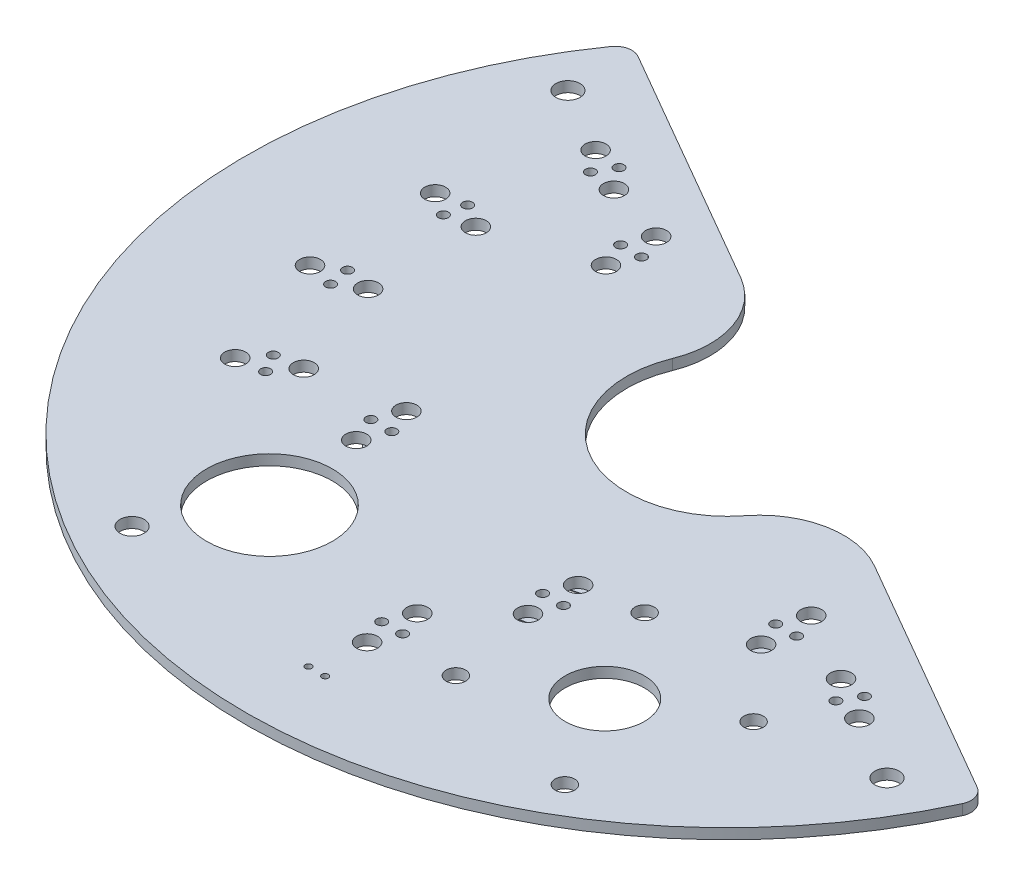
from build123d import *

# Parameters (mm, degrees)
SKETCH1_R           = 73.025
SKETCH1_R_2         = 15.24
SKETCH1_R_3         = 0.75
SKETCH1_R_4         = 1.585
SKETCH1_R_5         = 20
SKETCH1_R_6         = 9.525
SKETCH1_R_7         = 6
BOSS_EXTRUDE1_DEPTH = 1.5875
SKETCH2_R           = 1.8288
CUT_EXTRUDE1_DEPTH  = 104.285146107
CUT_EXTRUDE2_DEPTH  = 104.285146107
FILLET1_R           = 12.7
FILLET2_R           = 2.54
SKETCH4_R           = 0.4953
CUT_EXTRUDE3_DEPTH  = 104.285146107
SKETCH5_R           = 0.75
SKETCH5_R_2         = 0.4953
BOSS_EXTRUDE2_DEPTH = 0.1016
SKETCH6_R           = 1.4732
CUT_EXTRUDE4_DEPTH  = 104.285146107


with BuildPart() as part:
    # Sketch1 → Boss-Extrude1 (new body)
    with BuildSketch(Plane(origin=(0, 0, 0), x_dir=(1, 0, 0), z_dir=(0, 1, 0))):
        Circle(SKETCH1_R)
        Circle(SKETCH1_R_2, mode=Mode.SUBTRACT)
        with Locations((-1.585, 50.8)):
            Circle(SKETCH1_R_3, mode=Mode.SUBTRACT)
        with Locations((1.585, 50.8)):
            Circle(SKETCH1_R_3, mode=Mode.SUBTRACT)
        with Locations((0, 54.6)):
            Circle(SKETCH1_R_4, mode=Mode.SUBTRACT)
        with Locations((0, 47)):
            Circle(SKETCH1_R_4, mode=Mode.SUBTRACT)
        with Locations((47.284987047, 27.3)):
            Circle(SKETCH1_R_4, mode=Mode.SUBTRACT)
        with Locations((43.201590512, 26.772650265)):
            Circle(SKETCH1_R_3, mode=Mode.SUBTRACT)
        with Locations((44.786590512, 24.027349735)):
            Circle(SKETCH1_R_3, mode=Mode.SUBTRACT)
        with Locations((40.703193978, 23.5)):
            Circle(SKETCH1_R_4, mode=Mode.SUBTRACT)
        with Locations((47.284987047, -27.3)):
            Circle(SKETCH1_R_4, mode=Mode.SUBTRACT)
        with Locations((44.786590512, -24.027349735)):
            Circle(SKETCH1_R_3, mode=Mode.SUBTRACT)
        with Locations((43.201590512, -26.772650265)):
            Circle(SKETCH1_R_3, mode=Mode.SUBTRACT)
        with Locations((40.703193978, -23.5)):
            Circle(SKETCH1_R_4, mode=Mode.SUBTRACT)
        with Locations((0, -54.6)):
            Circle(SKETCH1_R_4, mode=Mode.SUBTRACT)
        with Locations((1.585, -50.8)):
            Circle(SKETCH1_R_3, mode=Mode.SUBTRACT)
        with Locations((-1.585, -50.8)):
            Circle(SKETCH1_R_3, mode=Mode.SUBTRACT)
        with Locations((0, -47)):
            Circle(SKETCH1_R_4, mode=Mode.SUBTRACT)
        with Locations((-47.284987047, -27.3)):
            Circle(SKETCH1_R_4, mode=Mode.SUBTRACT)
        with Locations((-43.201590512, -26.772650265)):
            Circle(SKETCH1_R_3, mode=Mode.SUBTRACT)
        with Locations((-44.786590512, -24.027349735)):
            Circle(SKETCH1_R_3, mode=Mode.SUBTRACT)
        with Locations((-40.703193978, -23.5)):
            Circle(SKETCH1_R_4, mode=Mode.SUBTRACT)
        with Locations((-47.284987047, 27.3)):
            Circle(SKETCH1_R_4, mode=Mode.SUBTRACT)
        with Locations((-44.786590512, 24.027349735)):
            Circle(SKETCH1_R_3, mode=Mode.SUBTRACT)
        with Locations((-43.201590512, 26.772650265)):
            Circle(SKETCH1_R_3, mode=Mode.SUBTRACT)
        with Locations((-40.703193978, 23.5)):
            Circle(SKETCH1_R_4, mode=Mode.SUBTRACT)
        with Locations((25.4, 43.994090512)):
            Circle(SKETCH1_R_5, mode=Mode.SUBTRACT)
        with Locations((-25.4, -43.994090512)):
            Circle(SKETCH1_R_6, mode=Mode.SUBTRACT)
        with Locations((25.4, -43.994090512)):
            Circle(SKETCH1_R_7, mode=Mode.SUBTRACT)
        with Locations((-46.285964392, 8.16146435)):
            Circle(SKETCH1_R_4, mode=Mode.SUBTRACT)
        with Locations((-50.303466215, 7.260407137)):
            Circle(SKETCH1_R_3, mode=Mode.SUBTRACT)
        with Locations((-49.753001491, 10.382247714)):
            Circle(SKETCH1_R_3, mode=Mode.SUBTRACT)
        with Locations((-53.770503314, 9.481190501)):
            Circle(SKETCH1_R_4, mode=Mode.SUBTRACT)
        with Locations((-46.285964392, -8.16146435)):
            Circle(SKETCH1_R_4, mode=Mode.SUBTRACT)
        with Locations((-49.753001491, -10.382247714)):
            Circle(SKETCH1_R_3, mode=Mode.SUBTRACT)
        with Locations((-50.303466215, -7.260407137)):
            Circle(SKETCH1_R_3, mode=Mode.SUBTRACT)
        with Locations((-53.770503314, -9.481190501)):
            Circle(SKETCH1_R_4, mode=Mode.SUBTRACT)
        with Locations((28.557059846, -21.251142254)):
            Circle(SKETCH1_R_3, mode=Mode.SUBTRACT)
        with Locations((31.727059846, -21.251142254)):
            Circle(SKETCH1_R_3, mode=Mode.SUBTRACT)
        with Locations((30.142059846, -17.451142254)):
            Circle(SKETCH1_R_4, mode=Mode.SUBTRACT)
        with Locations((30.142059846, -25.051142254)):
            Circle(SKETCH1_R_4, mode=Mode.SUBTRACT)
        with Locations((6.888157479, -34.898100149)):
            Circle(SKETCH1_R_3, mode=Mode.SUBTRACT)
        with Locations((10.058157479, -34.898100149)):
            Circle(SKETCH1_R_3, mode=Mode.SUBTRACT)
        with Locations((8.473157479, -31.098100149)):
            Circle(SKETCH1_R_4, mode=Mode.SUBTRACT)
        with Locations((8.473157479, -38.698100149)):
            Circle(SKETCH1_R_4, mode=Mode.SUBTRACT)
        with Locations((-28.936808022, -25.089763)):
            Circle(SKETCH1_R_3, mode=Mode.SUBTRACT)
        with Locations((-25.766808022, -25.089763)):
            Circle(SKETCH1_R_3, mode=Mode.SUBTRACT)
        with Locations((-27.351808022, -21.289763)):
            Circle(SKETCH1_R_4, mode=Mode.SUBTRACT)
        with Locations((-27.351808022, -28.889763)):
            Circle(SKETCH1_R_4, mode=Mode.SUBTRACT)
        with Locations((-32.936268133, 16.743623893)):
            Circle(SKETCH1_R_3, mode=Mode.SUBTRACT)
        with Locations((-29.766268133, 16.743623893)):
            Circle(SKETCH1_R_3, mode=Mode.SUBTRACT)
        with Locations((-31.351268133, 20.543623893)):
            Circle(SKETCH1_R_4, mode=Mode.SUBTRACT)
        with Locations((-31.351268133, 12.943623893)):
            Circle(SKETCH1_R_4, mode=Mode.SUBTRACT)
    extrude(amount=-BOSS_EXTRUDE1_DEPTH)

    # Sketch2 → Cut-Extrude1 (cut, through all)
    with BuildSketch(Plane(origin=(0, 0, 0), x_dir=(1, 0, 0), z_dir=(0, 1, 0))):
        with Locations((-57.192317666, 33.02)):
            Circle(SKETCH2_R)
        with Locations((33.02, 57.192317666)):
            Circle(SKETCH2_R)
        with Locations((57.192317666, -33.02)):
            Circle(SKETCH2_R)
        with Locations((-33.02, -57.192317666)):
            Circle(SKETCH2_R)
    extrude(amount=-CUT_EXTRUDE1_DEPTH, mode=Mode.SUBTRACT)

    # Sketch3 → Cut-Extrude2 (cut, through all)
    with BuildSketch(Plane(origin=(0, 0, 0), x_dir=(1, 0, 0), z_dir=(0, 1, 0))):
        with BuildLine():
            Line((-59.533825484, 44.637157955), (68.423825484, -29.239226276))
            ThreePointArc((68.423825484, -29.239226276), (37.204677955, 64.440392498), (-59.533825484, 44.637157955))
        make_face()
    extrude(amount=-CUT_EXTRUDE2_DEPTH, mode=Mode.SUBTRACT)

    # Fillet1
    fillet1_edges = [part.edges().sort_by_distance(p)[0] for p in [
        (15.165033815, -0.79375, -1.509751431),
        (-6.275033815, -0.79375, -13.888180249),
    ]]
    fillet(fillet1_edges, radius=FILLET1_R)

    # Fillet2
    fillet2_edges = [part.edges().sort_by_distance(p)[0] for p in [
        (67.216123088, -0.79375, 28.541958973),
        (-58.326123088, -0.79375, -43.939890652),
    ]]
    fillet(fillet2_edges, radius=FILLET2_R)

    # Sketch4 → Cut-Extrude3 (cut, through all)
    with BuildSketch(Plane(origin=(0, 0, 0), x_dir=(1, 0, 0), z_dir=(0, 1, 0))):
        with Locations((1.27, -62.23)):
            Circle(SKETCH4_R)
        with Locations((-1.27, -62.23)):
            Circle(SKETCH4_R)
    extrude(amount=-CUT_EXTRUDE3_DEPTH, mode=Mode.SUBTRACT)

    # Sketch5 → Boss-Extrude2 (add)
    # profile 1 of 7: a face of its own
    with BuildSketch(Plane.XZ.offset(1.5875)):
        with BuildLine():
            Line((30.413547782, 24.598324481), (41.535902061, 31.019818718))
            ThreePointArc((41.535902061, 31.019818718), (42.622921377, 29.508420604), (43.654971217, 27.958966385))
            ThreePointArc((43.654971217, 27.958966385), (43.878655246, 25.698181398), (41.935772719, 26.875632368))
            ThreePointArc((41.935772719, 26.875632368), (41.454257835, 27.61255432), (40.959794735, 28.340851504))
            Line((40.959794735, 28.340851504), (29.89025274, 21.949848454))
            ThreePointArc((29.89025274, 21.949848454), (18.542, 32.115686074), (4.064, 36.860642425))
            Line((4.064, 36.860642425), (4.064, 49.642648525))
            ThreePointArc((4.064, 49.642648525), (3.186044586, 49.706717539), (2.307094012, 49.755260685))
            ThreePointArc((2.307094012, 49.755260685), (0.315950299, 50.849120827), (2.385689544, 51.785797268))
            ThreePointArc((2.385689544, 51.785797268), (4.24358118, 51.666742998), (6.096, 51.481055713))
            Line((6.096, 51.481055713), (6.096, 38.638067239))
            ThreePointArc((6.096, 38.638067239), (19.558, 33.875449694), (30.413547782, 24.598324481))
        make_face()
        with Locations((1.585, 50.8)):
            Circle(SKETCH5_R, mode=Mode.SUBTRACT)
        with Locations((43.201590512, 26.772650265)):
            Circle(SKETCH5_R, mode=Mode.SUBTRACT)
    # profile 2 of 7: a face of its own
    with BuildSketch(Plane.XZ.offset(1.5875)):
        with BuildLine():
            Line((28.012465947, 9.133950273), (57.7422016, 26.298421156))
            ThreePointArc((57.7422016, 26.298421156), (34.873073505, 53.006014236), (1.294606888, 63.435737514))
            ThreePointArc((1.294606888, 63.435737514), (0.064262486, 62.254606888), (1.245393112, 61.024262486))
            ThreePointArc((1.245393112, 61.024262486), (32.789239067, 51.481816376), (54.774266163, 26.931234326))
            Line((54.774266163, 26.931234326), (46.78921353, 22.321062039))
            ThreePointArc((46.78921353, 22.321062039), (46.421042914, 23.07698178), (46.040660761, 23.826830883))
            ThreePointArc((46.040660761, 23.826830883), (44.194605545, 25.150939428), (44.242866733, 22.879628318))
            ThreePointArc((44.242866733, 22.879628318), (44.640302422, 22.09416322), (45.023794735, 21.301797022))
            Line((45.023794735, 21.301797022), (29.080316768, 12.096825726))
            ThreePointArc((29.080316768, 12.096825726), (-15.748, 27.276336118), (-25.016316768, -19.135880208))
            Line((-25.016316768, -19.135880208), (-40.959794735, -28.340851504))
            ThreePointArc((-40.959794735, -28.340851504), (-41.454257835, -27.61255432), (-41.935772719, -26.875632369))
            ThreePointArc((-41.935772719, -26.875632369), (-43.878655246, -25.698181398), (-43.654971217, -27.958966385))
            ThreePointArc((-43.654971217, -27.958966385), (-42.622921377, -29.508420604), (-41.535902061, -31.019818718))
            Line((-41.535902061, -31.019818718), (-21.916465947, -19.692531996))
            ThreePointArc((-21.916465947, -19.692531996), (-14.732, 25.516572497), (28.012465947, 9.133950273))
        make_face()
        with Locations((1.27, 62.23)):
            Circle(SKETCH5_R_2, mode=Mode.SUBTRACT)
        with Locations((44.786590512, 24.027349735)):
            Circle(SKETCH5_R, mode=Mode.SUBTRACT)
        with Locations((-43.201590512, -26.772650265)):
            Circle(SKETCH5_R, mode=Mode.SUBTRACT)
    # profile 3 of 7: a face of its own
    with BuildSketch(Plane.XZ.offset(1.5875)):
        with BuildLine():
            Line((-6.096, 38.638067239), (-6.096, 51.481055713))
            ThreePointArc((-6.096, 51.481055713), (-4.24358118, 51.666742998), (-2.385689544, 51.785797268))
            ThreePointArc((-2.385689544, 51.785797268), (-0.315950299, 50.849120827), (-2.307094012, 49.755260685))
            ThreePointArc((-2.307094012, 49.755260685), (-3.186044586, 49.706717539), (-4.064, 49.642648525))
            Line((-4.064, 49.642648525), (-4.064, 36.860642425))
            ThreePointArc((-4.064, 36.860642425), (-18.542, 32.115686074), (-29.89025274, 21.949848454))
            Line((-29.89025274, 21.949848454), (-40.959794734, 28.340851504))
            ThreePointArc((-40.959794734, 28.340851504), (-41.454257834, 27.612554318), (-41.935772719, 26.875632366))
            ThreePointArc((-41.935772719, 26.875632366), (-43.878655247, 25.698181399), (-43.654971218, 27.958966385))
            ThreePointArc((-43.654971218, 27.958966385), (-42.622921377, 29.508420604), (-41.535902061, 31.019818718))
            Line((-41.535902061, 31.019818718), (-30.413547782, 24.598324481))
            ThreePointArc((-30.413547782, 24.598324481), (-19.558, 33.875449694), (-6.096, 38.638067239))
        make_face()
        with Locations((-1.585, 50.8)):
            Circle(SKETCH5_R, mode=Mode.SUBTRACT)
        with Locations((-43.201590512, 26.772650265)):
            Circle(SKETCH5_R, mode=Mode.SUBTRACT)
    # profile 4 of 7: a face of its own
    with BuildSketch(Plane.XZ.offset(1.5875)):
        with BuildLine():
            ThreePointArc((-1.137328397, 61.026372169), (-0.059313178, 62.253645904), (-1.184427719, 63.437890349))
            ThreePointArc((-1.184427719, 63.437890349), (-54.638937722, 32.254538991), (-56.114446604, -29.613133627))
            ThreePointArc((-56.114446604, -29.613133627), (-54.535716158, -29.885091506), (-54.048929792, -28.358857598))
            ThreePointArc((-54.048929792, -28.358857598), (-52.52438099, 31.091815927), (-1.137328397, 61.026372169))
        make_face()
        with Locations((-1.27, 62.23)):
            Circle(SKETCH5_R_2, mode=Mode.SUBTRACT)
    # profile 5 of 7: a face of its own
    with BuildSketch(Plane.XZ.offset(1.5875)):
        with BuildLine():
            ThreePointArc((-48.598743805, -10.911954419), (-50.02174423, -9.141007471), (-50.584784004, -11.341954884))
            ThreePointArc((-50.584784004, -11.341954884), (-48.714342613, -17.730570693), (-46.040660762, -23.826830883))
            ThreePointArc((-46.040660762, -23.826830883), (-44.194605545, -25.150939428), (-44.242866733, -22.879628318))
            ThreePointArc((-44.242866733, -22.879628318), (-46.804887207, -17.035585761), (-48.598743805, -10.911954419))
        make_face()
        with Locations((-49.753001492, -10.382247714)):
            Circle(SKETCH5_R, mode=Mode.SUBTRACT)
        with Locations((-44.786590512, -24.027349735)):
            Circle(SKETCH5_R, mode=Mode.SUBTRACT)
    # profile 6 of 7: a face of its own
    with BuildSketch(Plane.XZ.offset(1.5875)):
        with BuildLine():
            ThreePointArc((-51.413325287, -6.643063765), (-50.131472617, -8.518706863), (-49.399989148, -6.367866276))
            ThreePointArc((-49.399989148, -6.367866276), (-49.808720609, 0), (-49.399989147, 6.367866276))
            ThreePointArc((-49.399989147, 6.367866276), (-50.131472618, 8.518706864), (-51.413325287, 6.643063765))
            ThreePointArc((-51.413325287, 6.643063765), (-51.840720609, 0), (-51.413325287, -6.643063765))
        make_face()
        with Locations((-50.303466215, 7.260407137)):
            Circle(SKETCH5_R, mode=Mode.SUBTRACT)
        with Locations((-50.303466215, -7.260407137)):
            Circle(SKETCH5_R, mode=Mode.SUBTRACT)
    # profile 7 of 7: a face of its own
    with BuildSketch(Plane.XZ.offset(1.5875)):
        with BuildLine():
            ThreePointArc((-50.584784004, 11.341954884), (-50.021744231, 9.141007472), (-48.598743805, 10.911954418))
            ThreePointArc((-48.598743805, 10.911954418), (-46.804887206, 17.035585761), (-44.242866731, 22.879628319))
            ThreePointArc((-44.242866731, 22.879628319), (-44.194605545, 25.150939428), (-46.040660762, 23.826830883))
            ThreePointArc((-46.040660762, 23.826830883), (-46.866502558, 22.158322394), (-47.631902061, 20.461236995))
            ThreePointArc((-47.631902061, 20.461236995), (-49.319566928, 15.969991589), (-50.584784004, 11.341954884))
        make_face()
        with Locations((-44.786590512, 24.027349735)):
            Circle(SKETCH5_R, mode=Mode.SUBTRACT)
        with Locations((-49.753001492, 10.382247714)):
            Circle(SKETCH5_R, mode=Mode.SUBTRACT)
    extrude(amount=BOSS_EXTRUDE2_DEPTH)

    # Sketch6 → Cut-Extrude4 (cut, through all)
    with BuildSketch(Plane.XZ.offset(1.5875)):
        with Locations((33.655, 58.292169929)):
            Circle(SKETCH6_R)
        with Locations((11.101920584, 52.249090512)):
            Circle(SKETCH6_R)
        with Locations((17.145, 29.696011096)):
            Circle(SKETCH6_R)
        with Locations((39.698079417, 35.739090512)):
            Circle(SKETCH6_R)
    extrude(amount=-CUT_EXTRUDE4_DEPTH, mode=Mode.SUBTRACT)


solid = part.part
